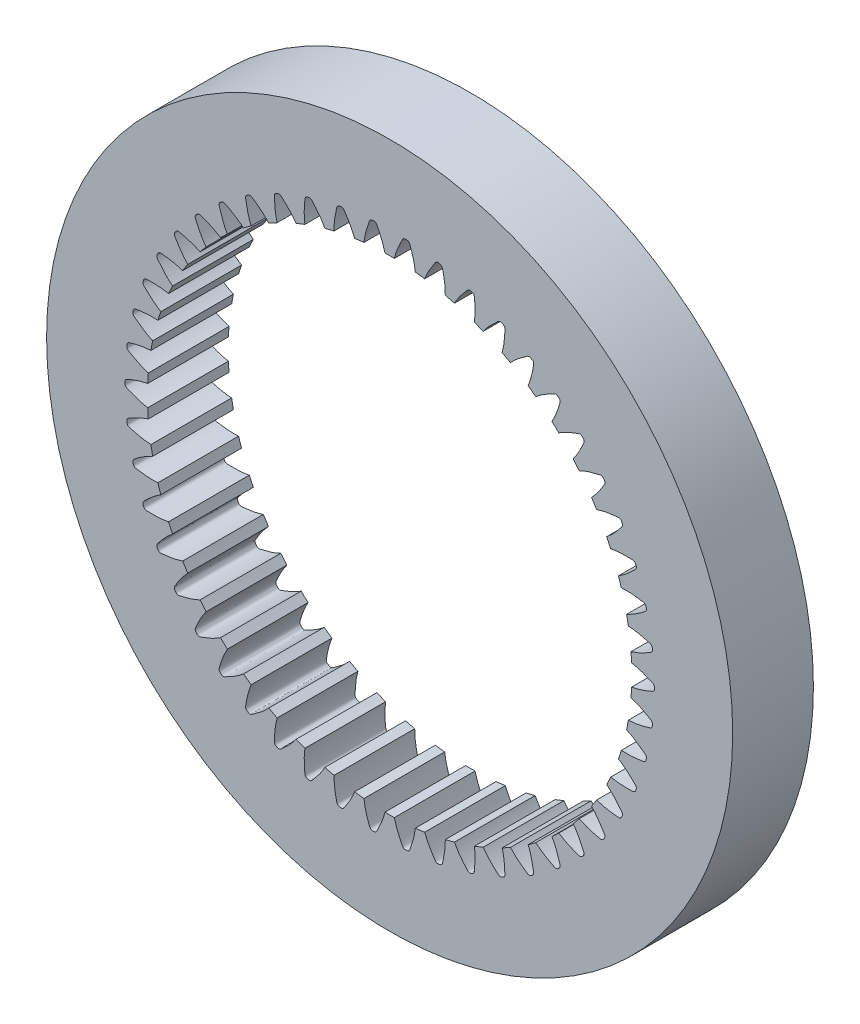
from build123d import *

# Parameters (mm, degrees)
SKETCHREVOLVESPURGEAR_W       = 8
SKETCHREVOLVESPURGEAR_H       = 10
TOOTHEXTRUDECUTSPURGEAR_DEPTH = 5
PATTERNSPURGEAR_COUNT         = 50


with BuildPart() as part:
    # SketchRevolveSpurGear → SpurGear (revolve)
    with BuildSketch(Plane(origin=(0, 0, 0), x_dir=(0, 0, -1), z_dir=(1, 0, 0))):
        with Locations((-1, 29)):
            Rectangle(SKETCHREVOLVESPURGEAR_W, SKETCHREVOLVESPURGEAR_H)
    revolve(axis=Axis((0, 0, 0), (0, 0, -1)))

    # SketchToothSpurGear → ToothExtrudeCutSpurGear (cut, symmetric)
    with BuildSketch(Plane.XY):
        with BuildLine():
            ThreePointArc((23.94780253, -1.044938054), (23.970589095, 0), (23.94780253, 1.044938054))
            add(Edge.make_bspline(
                [(23.94780253, 1.044938054), (24.053371615, 1.028255487), (24.2208449, 0.996162427), (24.455288413, 0.941087635), (24.659253713, 0.886822049), (24.880971017, 0.820781687), (25.12000017, 0.742025199), (25.37537945, 0.648873169), (25.648076562, 0.542850515), (25.893180461, 0.429695482), (26.071183641, 0.363439423), (26.149493899, 0.304552897), (26.179209149, 0.27407372), (26.204439712, 0.239803383), (26.224508306, 0.202280798), (26.243967434, 0.14967925), (26.250725419, 0.094281168), (26.249809168, 0.04003871), (26.250095416, 0), (26.249809168, -0.04003871), (26.250725419, -0.094281168), (26.243967434, -0.14967925), (26.224508306, -0.202280798), (26.204439712, -0.239803383), (26.179209149, -0.27407372), (26.149493899, -0.304552897), (26.071183641, -0.363439423), (25.893180461, -0.429695482), (25.648076562, -0.542850515), (25.37537945, -0.648873169), (25.12000017, -0.742025199), (24.880971017, -0.820781687), (24.659253713, -0.886822049), (24.455288413, -0.941087635), (24.2208449, -0.996162427), (24.053371615, -1.028255487), (23.94780253, -1.044938054)],
                knots=[0, 0, 0, 0, 0.060156699, 0.095945407, 0.135541022, 0.178943543, 0.22615297, 0.277169304, 0.331992543, 0.390622689, 0.429645943, 0.437604728, 0.445563514, 0.453522299, 0.461481085, 0.469439871, 0.484977605, 0.492488811, 0.5, 0.507511189, 0.515022395, 0.530560129, 0.538518915, 0.546477701, 0.554436486, 0.562395272, 0.570354057, 0.609377311, 0.668007457, 0.722830696, 0.77384703, 0.821056457, 0.864458978, 0.904054593, 0.939843301, 1, 1, 1, 1], degree=3))
        make_face()
    toothextrudecutspurgear = extrude(amount=TOOTHEXTRUDECUTSPURGEAR_DEPTH, both=True, mode=Mode.SUBTRACT)

    # PatternSpurGear: ToothExtrudeCutSpurGear ×50 about axis
    patternspurgear_axis = Axis((0, 0, 50), (0, 0, -1))
    for i in range(1, PATTERNSPURGEAR_COUNT):
        add(toothextrudecutspurgear.rotate(patternspurgear_axis, i * 360 / PATTERNSPURGEAR_COUNT), mode=Mode.SUBTRACT)


solid = part.part
